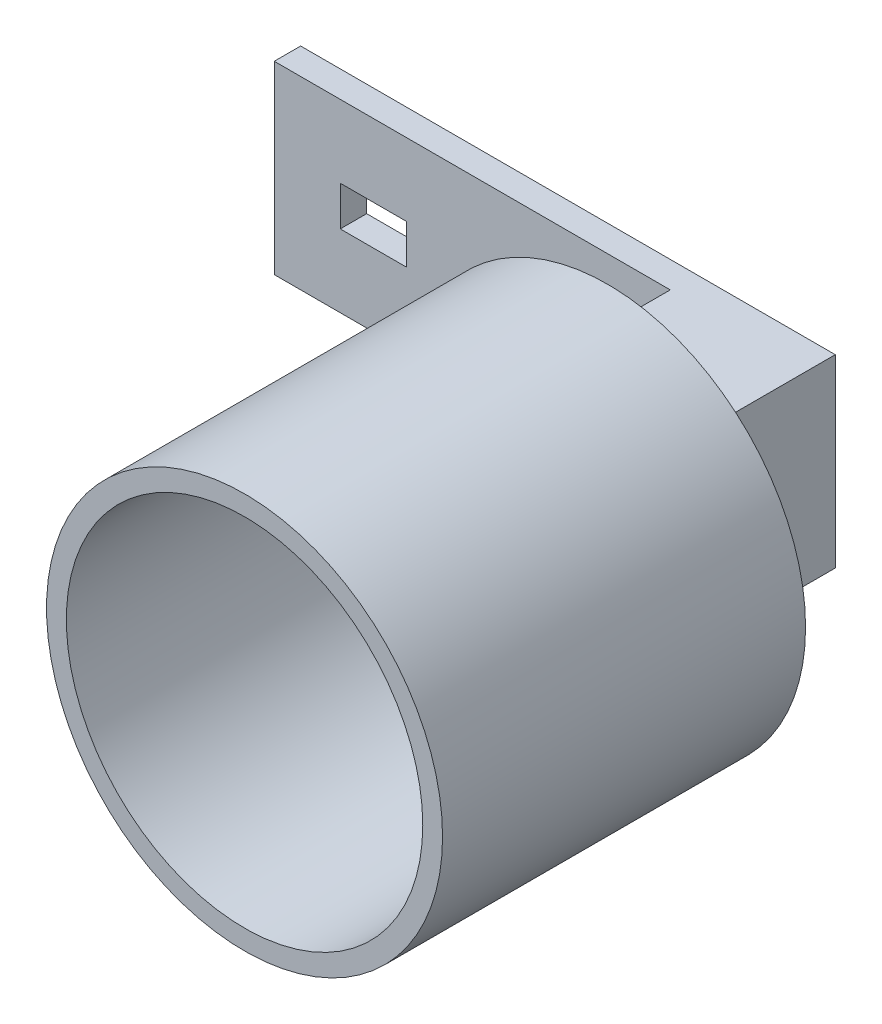
from build123d import *

# Parameters (mm, degrees)
ESQUISSE1_R             = 30
BOSS_EXTRU_1_DEPTH      = 55
ESQUISSE2_R             = 27
ENL_V_MAT_EXTRU_1_DEPTH = 47
ESQUISSE3_W             = 21
ESQUISSE3_H             = 28
BOSS_EXTRU_2_DEPTH      = 24
ESQUISSE4_W             = 4
ESQUISSE4_H             = 28
BOSS_EXTRU_3_DEPTH      = 60
ENL_V_MAT_EXTRU_2_REACH = 112.051
ESQUISSE5_W             = 10
ESQUISSE5_H             = 6


with BuildPart() as part:
    # Esquisse1 → Boss.-Extru.1 (new body)
    with BuildSketch(Plane.XY):
        Circle(ESQUISSE1_R)
    extrude(amount=BOSS_EXTRU_1_DEPTH)

    # Esquisse2 → Enlèv. mat.-Extru.1 (cut)
    with BuildSketch(Plane.XY.offset(55)):
        Circle(ESQUISSE2_R)
    extrude(amount=-ENL_V_MAT_EXTRU_1_DEPTH, mode=Mode.SUBTRACT)

    # Esquisse3 → Boss.-Extru.2 (add)
    with BuildSketch(Plane(origin=(0, 0, 0), x_dir=(-1, 0, 0), z_dir=(0, 0, -1))):
        Rectangle(ESQUISSE3_W, ESQUISSE3_H)
    extrude(amount=BOSS_EXTRU_2_DEPTH)

    # Esquisse4 → Boss.-Extru.3 (add)
    with BuildSketch(Plane.ZY.offset(10.5)):
        with Locations((-22, 0)):
            Rectangle(ESQUISSE4_W, ESQUISSE4_H)
    extrude(amount=BOSS_EXTRU_3_DEPTH)

    # Esquisse5 → Enlèv. mat.-Extru.2 (cut, up to next)
    with BuildSketch(Plane(origin=(0, 0, -24), x_dir=(-1, 0, 0), z_dir=(0, 0, -1)), mode=Mode.PRIVATE) as enl_v_mat_extru_2_sk1:
        with Locations((55.5, 0)):
            Rectangle(ESQUISSE5_W, ESQUISSE5_H)
    enl_v_mat_extru_2_tool1 = extrude(enl_v_mat_extru_2_sk1.sketch, amount=-ENL_V_MAT_EXTRU_2_REACH, mode=Mode.PRIVATE) & part.part
    add(enl_v_mat_extru_2_tool1.solids().sort_by_distance((-55.5, 0, -24))[0], mode=Mode.SUBTRACT)


solid = part.part
